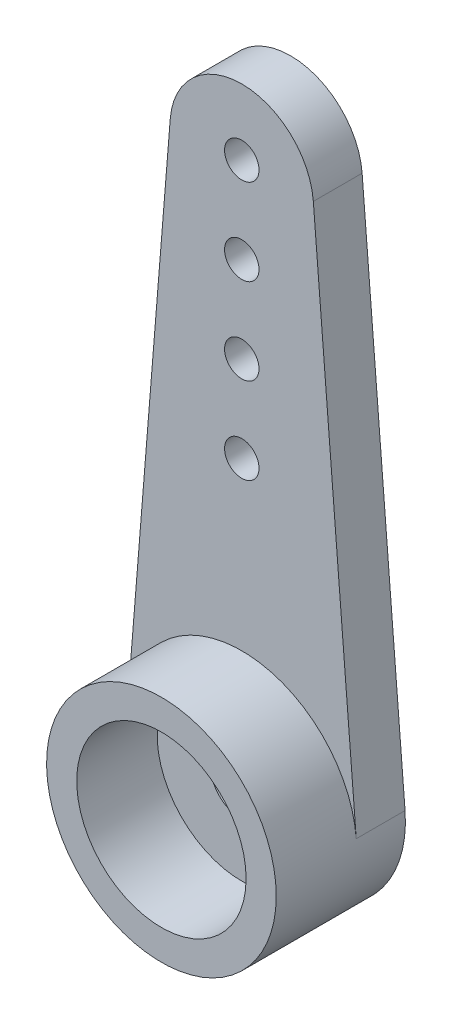
from build123d import *

# Parameters (mm, degrees)
SKETCH_1_R          = 4
SKETCH_1_R_2        = 2.95
EXTRUDE_1_DEPTH     = 4.5
SKETCH_1_3_R        = 2.95
SKETCH_1_3_R_2      = 1.1
EXTRUDE_2_DEPTH     = 1.7
SKETCH_1_4_R        = 2.95
SKETCH_1_4_R_2      = 1.1
CUT_EXTRUDE_1_DEPTH = 0.4
SKETCH_2_R          = 0.6
EXTRUDE_3_DEPTH     = 1.7


with BuildPart() as part:
    # Эскиз1 → Бобышка-Вытянуть1 (new body)
    with BuildSketch(Plane.XY):
        Circle(SKETCH_1_R)
        Circle(SKETCH_1_R_2, mode=Mode.SUBTRACT)
    extrude(amount=EXTRUDE_1_DEPTH)

    # Эскиз1<3> → Бобышка-Вытянуть2 (add)
    with BuildSketch(Plane.XY):
        Circle(SKETCH_1_3_R)
        Circle(SKETCH_1_3_R_2, mode=Mode.SUBTRACT)
    extrude(amount=EXTRUDE_2_DEPTH)

    # Эскиз1<4> → Вырез-Вытянуть1 (cut)
    with BuildSketch(Plane.XY):
        Circle(SKETCH_1_4_R)
        Circle(SKETCH_1_4_R_2, mode=Mode.SUBTRACT)
    extrude(amount=CUT_EXTRUDE_1_DEPTH, mode=Mode.SUBTRACT)

    # Эскиз2 → Бобышка-Вытянуть3 (add)
    with BuildSketch(Plane.XY):
        with BuildLine():
            ThreePointArc((2.491857186, 18.801612903), (0, 21.1), (-2.491857186, 18.801612903))
            Line((-2.491857186, 18.801612903), (-3.986971498, 0.322580645))
            ThreePointArc((-3.986971498, 0.322580645), (0, 4), (3.986971498, 0.322580645))
            Line((3.986971498, 0.322580645), (2.491857186, 18.801612903))
        make_face()
        with Locations((0, 9.801612903)):
            Circle(SKETCH_2_R, mode=Mode.SUBTRACT)
        with Locations((0, 12.801612903)):
            Circle(SKETCH_2_R, mode=Mode.SUBTRACT)
        with Locations((0, 15.801612903)):
            Circle(SKETCH_2_R, mode=Mode.SUBTRACT)
        with Locations((0, 18.801612903)):
            Circle(SKETCH_2_R, mode=Mode.SUBTRACT)
    extrude(amount=EXTRUDE_3_DEPTH)


solid = part.part
